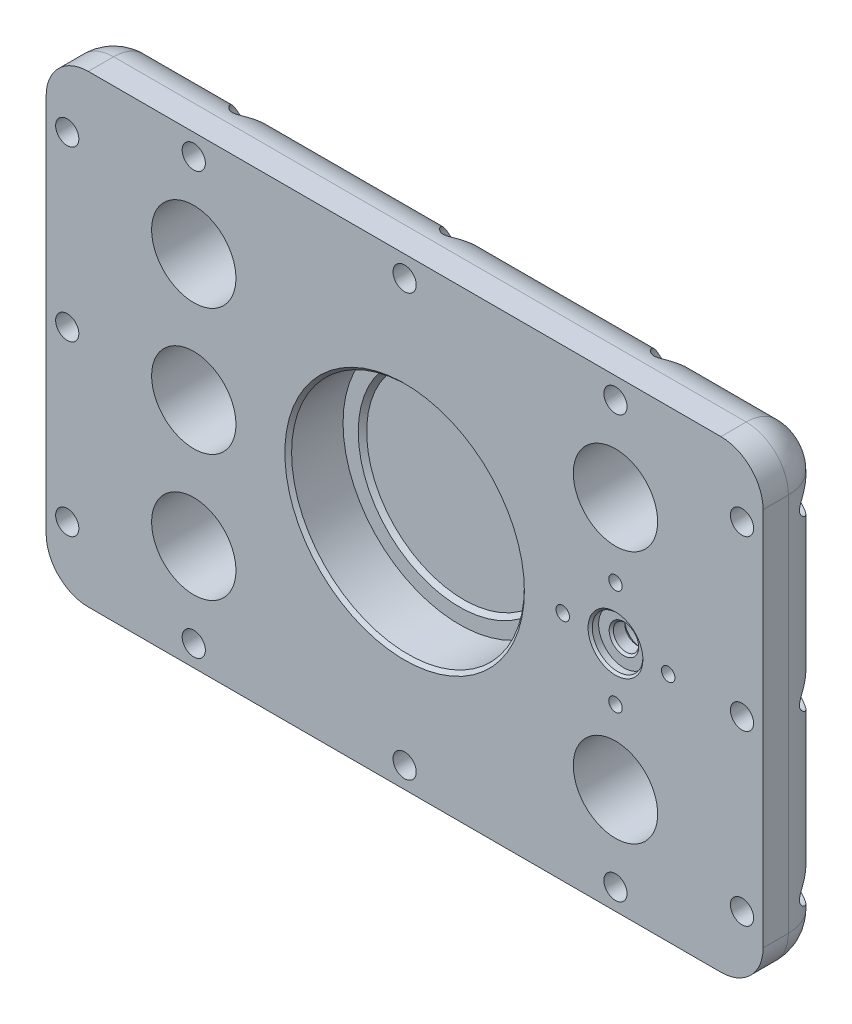
from build123d import *

# Parameters (mm, degrees)
SKETCH1_W           = 170
SKETCH1_H           = 110
BOSS_EXTRUDE1_DEPTH = 16
FILLET1_R           = 10
SKETCH2_R           = 27.6
CUT_EXTRUDE1_DEPTH  = 13
SKETCH3_R           = 23
CUT_EXTRUDE2_DEPTH  = 1
CHAMFER1_SIZE       = 1
SKETCH4_R           = 6
CUT_EXTRUDE4_DEPTH  = 2
SKETCH5_R           = 3
CUT_EXTRUDE3_DEPTH  = 103.205674989
CHAMFER2_SIZE       = 0.8
CHAMFER3_SIZE       = 0.5
SKETCH6_R           = 1.6
CUT_EXTRUDE5_DEPTH  = 103.498780481
SKETCH7_R           = 3
CUT_EXTRUDE6_DEPTH  = 10
CIRPATTERN1_COUNT   = 4
CHAMFER4_SIZE       = 0.5
SKETCH8_R           = 8
CUT_EXTRUDE7_DEPTH  = 10
CHAMFER5_SIZE       = 0.8
FILLET2_R           = 10
SKETCH10_R          = 2.75
CUT_EXTRUDE8_DEPTH  = 103.498780481
SKETCH11_R          = 4.5
CUT_EXTRUDE9_DEPTH  = 10
SKETCH15_R          = 10
CUT_EXTRUDE10_DEPTH = 103.498780617


with BuildPart() as part:
    # Sketch1 → Boss-Extrude1 (new body)
    with BuildSketch(Plane.XY):
        Rectangle(SKETCH1_W, SKETCH1_H)
    extrude(amount=BOSS_EXTRUDE1_DEPTH)

    # Fillet1
    fillet1_edges = [part.edges().sort_by_distance(p)[0] for p in [
        (85, -55, 8),
        (-85, -55, 8),
        (-85, 55, 8),
        (85, 55, 8),
    ]]
    fillet(fillet1_edges, radius=FILLET1_R)

    # Sketch2 → Cut-Extrude1 (cut)
    with BuildSketch(Plane.XY.offset(16)):
        Circle(SKETCH2_R)
    extrude(amount=-CUT_EXTRUDE1_DEPTH, mode=Mode.SUBTRACT)

    # Sketch3 → Cut-Extrude2 (cut)
    with BuildSketch(Plane.XY.offset(3)):
        Circle(SKETCH3_R)
    extrude(amount=-CUT_EXTRUDE2_DEPTH, mode=Mode.SUBTRACT)

    # Chamfer1
    chamfer1_edges = [part.edges().sort_by_distance(p)[0] for p in [
        (-23, 0, 3),
    ]]
    chamfer(chamfer1_edges, length=CHAMFER1_SIZE - 0.0001)  # a hair under: the kernel refuses the full size

    # Sketch4 → Cut-Extrude4 (cut)
    with BuildSketch(Plane.XY.offset(16)):
        with Locations((50, 0)):
            Circle(SKETCH4_R)
    extrude(amount=-CUT_EXTRUDE4_DEPTH, mode=Mode.SUBTRACT)

    # Sketch5 → Cut-Extrude3 (cut, through all)
    with BuildSketch(Plane.XY.offset(14)):
        with Locations((50, 0)):
            Circle(SKETCH5_R)
    extrude(amount=-CUT_EXTRUDE3_DEPTH, mode=Mode.SUBTRACT)

    # Chamfer2
    chamfer2_edges = [part.edges().sort_by_distance(p)[0] for p in [
        (-27.6, 0, 16),
    ]]
    chamfer(chamfer2_edges, length=CHAMFER2_SIZE)

    # Chamfer3
    chamfer3_edges = [part.edges().sort_by_distance(p)[0] for p in [
        (44, 0, 16),
        (47, 0, 14),
    ]]
    chamfer(chamfer3_edges, length=CHAMFER3_SIZE)

    # Sketch6 → Cut-Extrude5 (cut, through all)
    with BuildSketch(Plane(origin=(0, 0, 0), x_dir=(-1, 0, 0), z_dir=(0, 0, -1))):
        with Locations((-62.5, 0)):
            Circle(SKETCH6_R)
        with Locations((-50, 12.5)):
            Circle(SKETCH6_R)
        with Locations((-37.5, 0)):
            Circle(SKETCH6_R)
        with Locations((-50, -12.5)):
            Circle(SKETCH6_R)
    extrude(amount=-CUT_EXTRUDE5_DEPTH, mode=Mode.SUBTRACT)

    # Sketch7 → Cut-Extrude6 (cut)
    with BuildSketch(Plane(origin=(0, 0, 0), x_dir=(-1, 0, 0), z_dir=(0, 0, -1))):
        with Locations((-62.5, 0)):
            Circle(SKETCH7_R)
    cut_extrude6 = extrude(amount=-CUT_EXTRUDE6_DEPTH, mode=Mode.SUBTRACT)

    # CirPattern1: Cut-Extrude6 ×4 about axis
    cirpattern1_axis = Axis((50, 0, 0), (0, 0, 1))
    for i in range(1, CIRPATTERN1_COUNT):
        add(cut_extrude6.rotate(cirpattern1_axis, i * 360 / CIRPATTERN1_COUNT), mode=Mode.SUBTRACT)

    # Chamfer4
    chamfer4_edges = [part.edges().sort_by_distance(p)[0] for p in [
        (50, 15.5, 0),
        (34.5, 0, 0),
        (50, -15.5, 0),
        (47, 0, 0),
        (65.5, 0, 0),
    ]]
    chamfer(chamfer4_edges, length=CHAMFER4_SIZE)

    # Sketch8 → Cut-Extrude7 (cut)
    with BuildSketch(Plane(origin=(0, 0, 0), x_dir=(-1, 0, 0), z_dir=(0, 0, -1))):
        with Locations((-50, 0)):
            Circle(SKETCH8_R)
    extrude(amount=-CUT_EXTRUDE7_DEPTH, mode=Mode.SUBTRACT)

    # Chamfer5
    chamfer5_edges = [part.edges().sort_by_distance(p)[0] for p in [
        (47, 0, 10),
        (58, 0, 0),
    ]]
    chamfer(chamfer5_edges, length=CHAMFER5_SIZE)

    # Fillet2
    fillet2_edges = [part.edges().sort_by_distance(p)[0] for p in [
        (0, -55, 0),
        (85, 0, 0),
        (-85, 0, 0),
        (0, 55, 0),
        (-82.071067812, 52.071067812, 0),
        (82.071067812, 52.071067812, 0),
        (82.071067812, -52.071067812, 0),
        (-82.071067812, -52.071067812, 0),
    ]]
    fillet(fillet2_edges, radius=FILLET2_R)

    # Sketch10 → Cut-Extrude8 (cut, through all)
    with BuildSketch(Plane(origin=(0, 0, 0), x_dir=(-1, 0, 0), z_dir=(0, 0, -1))):
        with Locations((-80, 40)):
            Circle(SKETCH10_R)
        with Locations((-80, 0)):
            Circle(SKETCH10_R)
        with Locations((-80, -40)):
            Circle(SKETCH10_R)
        with Locations((-50, -50)):
            Circle(SKETCH10_R)
        with Locations((0, -50)):
            Circle(SKETCH10_R)
        with Locations((50, -50)):
            Circle(SKETCH10_R)
        with Locations((80, -40)):
            Circle(SKETCH10_R)
        with Locations((80, 0)):
            Circle(SKETCH10_R)
        with Locations((80, 40)):
            Circle(SKETCH10_R)
        with Locations((50, 50)):
            Circle(SKETCH10_R)
        with Locations((0, 50)):
            Circle(SKETCH10_R)
        with Locations((-50, 50)):
            Circle(SKETCH10_R)
    extrude(amount=-CUT_EXTRUDE8_DEPTH, mode=Mode.SUBTRACT)

    # Sketch11 → Cut-Extrude9 (cut)
    with BuildSketch(Plane(origin=(0, 0, 0), x_dir=(-1, 0, 0), z_dir=(0, 0, -1))):
        with Locations((-50, 50)):
            Circle(SKETCH11_R)
        with Locations((-80, 40)):
            Circle(SKETCH11_R)
        with Locations((-80, 0)):
            Circle(SKETCH11_R)
        with Locations((-80, -40)):
            Circle(SKETCH11_R)
        with Locations((-50, -50)):
            Circle(SKETCH11_R)
        with Locations((0, -50)):
            Circle(SKETCH11_R)
        with Locations((50, -50)):
            Circle(SKETCH11_R)
        with Locations((80, -40)):
            Circle(SKETCH11_R)
        with Locations((80, 0)):
            Circle(SKETCH11_R)
        with Locations((80, 40)):
            Circle(SKETCH11_R)
        with Locations((50, 50)):
            Circle(SKETCH11_R)
        with Locations((0, 50)):
            Circle(SKETCH11_R)
    extrude(amount=-CUT_EXTRUDE9_DEPTH, mode=Mode.SUBTRACT)

    # Sketch15 → Cut-Extrude10 (cut, through all)
    with BuildSketch(Plane(origin=(0, 0, 0), x_dir=(-1, 0, 0), z_dir=(0, 0, -1))):
        with Locations((-50, -30)):
            Circle(SKETCH15_R)
        with Locations((50, -30)):
            Circle(SKETCH15_R)
        with Locations((50, 0)):
            Circle(SKETCH15_R)
        with Locations((50, 30)):
            Circle(SKETCH15_R)
        with Locations((-50, 30)):
            Circle(SKETCH15_R)
    extrude(amount=-CUT_EXTRUDE10_DEPTH, mode=Mode.SUBTRACT)


solid = part.part
